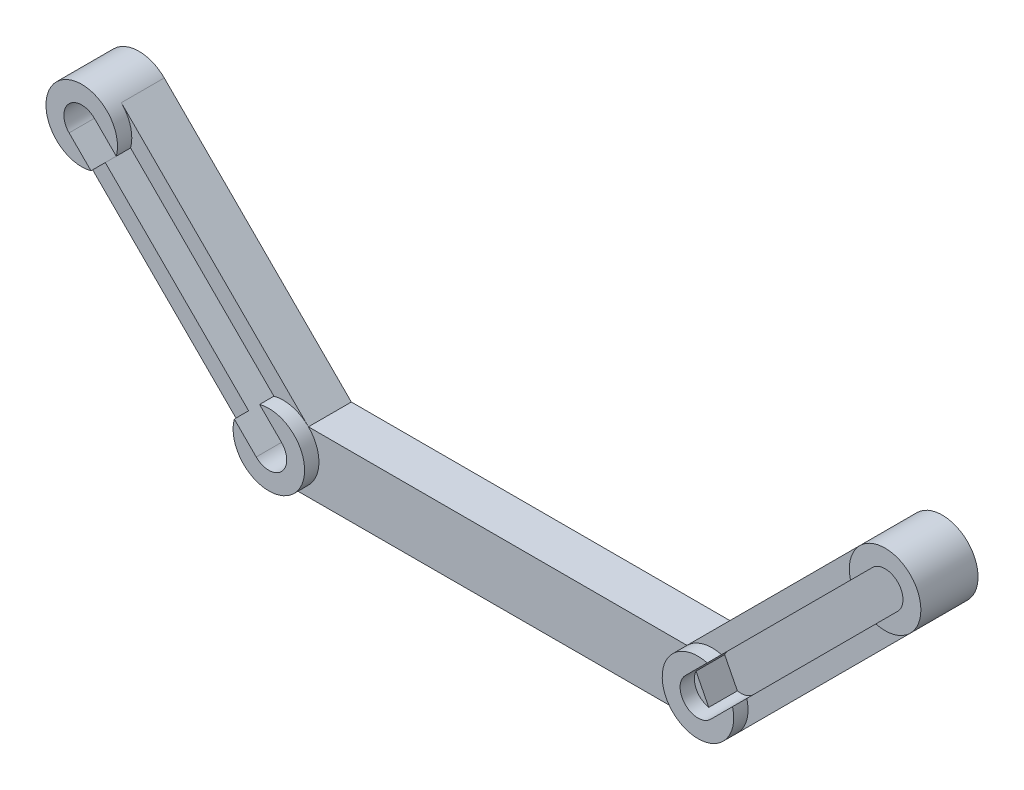
from build123d import *
from build123d.topology import SkipClean

# Parameters (mm, degrees)
SKETCH_1_R            = 5
SKETCH_1_R_2          = 2.5
EXTRUDE_1_DEPTH       = 10
EXTRUDE_1_2_DEPTH     = 10
EXTRUDE_1_3_DEPTH     = 10
EXTRUDE_1_4_DEPTH     = 10
EXTRUDE_2_DEPTH       = 6
CUT_EXTRUDE_1_DEPTH   = 4
EXTRUDE_START         = -2
EXTRUDE_3_OUTLINE_R   = 2.5
EXTRUDE_3_DEPTH       = 2
EXTRUDE_3_2_DEPTH     = 2
EXTRUDE_3_3_OUTLINE_R = 2.5
EXTRUDE_3_3_DEPTH     = 2
CUT_EXTRUDE_2_DEPTH   = 4
CUT_EXTRUDE_6_DEPTH   = 8
EXTRUDE_4_DEPTH       = 6
CUT_EXTRUDE_START     = -2
CUT_EXTRUDE_8_DEPTH   = 2
CUT_EXTRUDE_8_2_DEPTH = 2


with BuildPart() as part:
    # Эскиз1 → Бобышка-Вытянуть1 (new body)
    with BuildSketch(Plane.XY):
        with Locations((-11.277859903, 1.201925786)):
            Circle(SKETCH_1_R)
        with Locations((-11.277859903, 1.201925786)):
            Circle(SKETCH_1_R_2, mode=Mode.SUBTRACT)
    extrude(amount=EXTRUDE_1_DEPTH)



with BuildPart() as body_2:
    # Эскиз1 → Extrude 1 2 (new body)
    with BuildSketch(Plane.XY):
        with Locations((-37.440810807, -24.961025118)):
            Circle(SKETCH_1_R)
        with Locations((-37.440810807, -24.961025118)):
            Circle(SKETCH_1_R_2, mode=Mode.SUBTRACT)
    extrude(amount=EXTRUDE_1_2_DEPTH)


with BuildPart() as body_3:
    # Эскиз1 → Extrude 1 3 (new body)
    with BuildSketch(Plane.XY):
        with Locations((-97.440810807, -24.961025118)):
            Circle(SKETCH_1_R)
        with Locations((-97.440810807, -24.961025118)):
            Circle(SKETCH_1_R_2, mode=Mode.SUBTRACT)
    extrude(amount=EXTRUDE_1_3_DEPTH)


with BuildPart() as body_4:
    # Эскиз1 → Extrude 1 4 (new body)
    with BuildSketch(Plane.XY):
        with Locations((-123.603761711, 1.201925786)):
            Circle(SKETCH_1_R)
        with Locations((-123.603761711, 1.201925786)):
            Circle(SKETCH_1_R_2, mode=Mode.SUBTRACT)
    extrude(amount=EXTRUDE_1_4_DEPTH)


with BuildPart() as part_1:
    add(part.part)

    add(body_2.part)  # Бобышка-Вытянуть2 merges body 2
    # Эскиз3 → Бобышка-Вытянуть2 (add)
    with BuildSketch(Plane(origin=(0, 0, 0), x_dir=(-1, 0, 0), z_dir=(0, 0, -1))):
        Polygon((11.277859903, 1.201925786), (14.813393809, 4.737459692), (40.976344713, -21.425491212), (33.905276901, -28.496559024), (7.742325997, -2.33360812), align=None)
        Polygon((97.440810807, -24.961025118), (93.905276901, -21.425491212), (120.068227805, 4.737459692), (127.139295617, -2.33360812), (100.976344713, -28.496559024), align=None)
    extrude(amount=-EXTRUDE_2_DEPTH)

    # Эскиз4 → Вырез-Вытянуть1 (cut)
    with BuildSketch(Plane.XY.offset(6)):
        Polygon((-13.045626856, 2.969692739), (-9.51009295, -0.565841167), (-35.673043854, -26.728792071), (-39.20857776, -23.193258165), align=None)
    extrude(amount=-CUT_EXTRUDE_1_DEPTH, mode=Mode.SUBTRACT)

    # Extrude 3 2 outline → Extrude 3 2 (add)
    with BuildSketch(Plane(origin=(0, 0, 0), x_dir=(-1, 0, 0), z_dir=(0, 0, -1)).offset(EXTRUDE_START)):
        with BuildLine():
            Line((9.51009295, -0.565841167), (13.045626856, 2.969692739))
            ThreePointArc((13.045626856, 2.969692739), (9.51009295, 2.969692739), (9.51009295, -0.565841167))
        make_face()
        with BuildLine():
            Line((39.20857776, -23.193258165), (35.673043854, -26.728792071))
            ThreePointArc((35.673043854, -26.728792071), (39.20857776, -26.728792071), (39.20857776, -23.193258165))
        make_face()
    extrude(amount=EXTRUDE_3_2_DEPTH)

    # Эскиз4<2> → Вырез-Вытянуть2 (cut)
    with BuildSketch(Plane.XY.offset(6)):
        Polygon((-13.045626856, 2.969692739), (-9.51009295, -0.565841167), (-35.673043854, -26.728792071), (-39.20857776, -23.193258165), align=None)
    extrude(amount=CUT_EXTRUDE_2_DEPTH, mode=Mode.SUBTRACT)


with BuildPart() as body_4_2:
    # Бобышка-Вытянуть3: read off the stored shape, not the designer's step
    # Бобышка-Вытянуть3 outline → Бобышка-Вытянуть3 (new body)
    with BuildSketch(Plane(origin=(0, 0, 0), x_dir=(-1, 0, 0), z_dir=(0, 0, -1)).offset(EXTRUDE_START)):
        with Locations((123.603761711, 1.201925786)):
            Circle(EXTRUDE_3_OUTLINE_R)
    extrude(amount=EXTRUDE_3_DEPTH)


with BuildPart() as body_5:
    # Extrude 3 3 outline → Extrude 3 3 (new body)
    with BuildSketch(Plane(origin=(0, 0, 0), x_dir=(-1, 0, 0), z_dir=(0, 0, -1)).offset(EXTRUDE_START)):
        with Locations((97.440810807, -24.961025118)):
            Circle(EXTRUDE_3_3_OUTLINE_R)
    extrude(amount=EXTRUDE_3_3_DEPTH)


with BuildPart() as cut_extrude_6_tool:
    # Эскиз9 → Вырез-Вытянуть6 (new body)
    with BuildSketch(Plane.XY.offset(10)):
        Polygon((-123.603761711, 1.201925786), (-121.835994758, 2.969692739), (-95.673043854, -23.193258165), (-99.20857776, -26.728792071), (-125.371528664, -0.565841167), align=None)
    extrude(amount=-CUT_EXTRUDE_6_DEPTH)


with BuildPart() as part_2:
    add(part_1.part)

    # Вырез-Вытянуть6: cut by cut_extrude_6_tool
    add(cut_extrude_6_tool.part, mode=Mode.SUBTRACT)



with BuildPart() as body_3_1:
    add(body_3.part)

    # Вырез-Вытянуть6: cut by cut_extrude_6_tool
    add(cut_extrude_6_tool.part, mode=Mode.SUBTRACT)


with BuildPart() as body_4_1:
    add(body_4.part)

    # Вырез-Вытянуть6: cut by cut_extrude_6_tool
    add(cut_extrude_6_tool.part, mode=Mode.SUBTRACT)

    # Вырез-Вытянуть8: read off the stored shape, not the designer's step
    # Вырез-Вытянуть8 outline → Вырез-Вытянуть8 (cut)
    with BuildSketch(Plane.XY.offset(10).offset(CUT_EXTRUDE_START)):
        with BuildLine():
            ThreePointArc((-118.774132579, -0.092169439), (-127.139295617, 4.737459691), (-122.309666485, -3.627703345))
            Line((-122.309666485, -3.627703345), (-125.371528664, -0.565841167))
            ThreePointArc((-125.371528664, -0.565841167), (-125.371528664, 2.969692739), (-121.835994758, 2.969692739))
            Line((-121.835994758, 2.969692739), (-118.774132579, -0.092169439))
        make_face()
    extrude(amount=CUT_EXTRUDE_8_DEPTH, mode=Mode.SUBTRACT)


with BuildPart() as part_3:
    with SkipClean():  # the faces are left unmerged after this step: merging them gives an invalid solid
        add(part_2.part)

        add(body_3_1.part)  # Бобышка-Вытянуть4 merges body 3

        add(body_5.part)  # Бобышка-Вытянуть4 merges body 5
        # Эскиз10 → Бобышка-Вытянуть4 (add)
        with BuildSketch(Plane(origin=(0, 0, 0), x_dir=(-1, 0, 0), z_dir=(0, 0, -1))):
            Polygon((40.976344713, -21.425491212), (93.905276901, -21.425491212), (97.440810807, -29.961025118), (36.664459762, -29.900385305), align=None)
        extrude(amount=-EXTRUDE_4_DEPTH)

    # Cut-Extrude 8 2 outline → Cut-Extrude 8 2 (cut)
    with SkipClean():  # the faces are left unmerged after this step: merging them gives an invalid solid
        with BuildSketch(Plane.XY.offset(10).offset(CUT_EXTRUDE_START)):
            with BuildLine():
                Line((-32.611181676, -23.666929892), (-35.673043854, -26.728792071))
                ThreePointArc((-35.673043854, -26.728792071), (-39.20857776, -26.728792071), (-39.20857776, -23.193258165))
                Line((-39.20857776, -23.193258165), (-36.146715581, -20.131395986))
                ThreePointArc((-36.146715581, -20.131395986), (-40.976344714, -28.496559023), (-32.611181676, -23.666929892))
            make_face()
            with BuildLine():
                Line((-9.51009295, -0.565841167), (-12.571955129, -3.627703345))
                ThreePointArc((-12.571955129, -3.627703345), (-7.742325998, 4.737459693), (-16.107489035, -0.092169439))
                Line((-16.107489035, -0.092169439), (-13.045626856, 2.969692739))
                ThreePointArc((-13.045626856, 2.969692739), (-9.51009295, 2.969692739), (-9.51009295, -0.565841167))
            make_face()
            with BuildLine():
                Line((-98.734906032, -20.131395986), (-95.673043854, -23.193258165))
                ThreePointArc((-95.673043854, -23.193258165), (-95.673043854, -26.728792071), (-99.20857776, -26.728792071))
                Line((-99.20857776, -26.728792071), (-102.270439938, -23.666929892))
                ThreePointArc((-102.270439938, -23.666929892), (-93.9052769, -28.496559023), (-98.734906032, -20.131395986))
            make_face()
        extrude(amount=CUT_EXTRUDE_8_2_DEPTH, mode=Mode.SUBTRACT)


solid = Compound([body_4_2.part, body_4_1.part, part_3.part])
